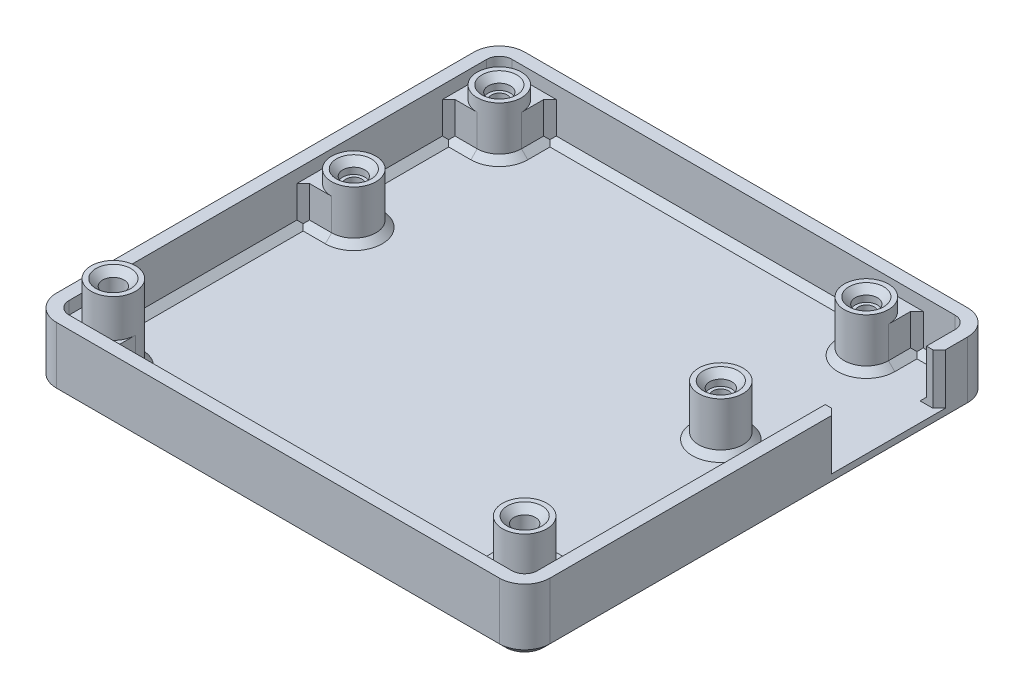
from build123d import *
from build123d.topology import SkipClean

# Parameters (mm, degrees)
BOSS_EXTRUDE1_DEPTH                  = 10
BOSS_EXTRUDE2_DEPTH                  = 2
SKETCH4_R                            = 3.5
BOSS_EXTRUDE3_DEPTH                  = 8
BOSS_EXTRUDE4_DEPTH                  = 12
CHAMFER3_SIZE                        = 1
CUT_EXTRUDE2_DEPTH                   = 4
CUT_EXTRUDE2_DEPTH_BACK              = 2
CHAMFER4_SIZE                        = 1
CHAMFER5_SIZE                        = 1
F_2_5_2_5_DIAMETER_HOLE1_D           = 2.5
F_2_5_2_5_DIAMETER_HOLE1_DEPTH       = 8
F_2_5_2_5_DIAMETER_HOLE1_CSINK_D     = 5.5
F_2_5_2_5_DIAMETER_HOLE1_CSINK_ANGLE = 90
F_3_5_3_5_DIAMETER_HOLE1_D           = 3.5
F_3_5_3_5_DIAMETER_HOLE1_DEPTH       = 2
F_2_5_2_5_DIAMETER_HOLE2_D           = 2.5
F_2_5_2_5_DIAMETER_HOLE2_DEPTH       = 12
F_2_5_2_5_DIAMETER_HOLE2_CSINK_D     = 5.5
F_2_5_2_5_DIAMETER_HOLE2_CSINK_ANGLE = 90
F_3_4_3_4_DIAMETER_HOLE1_D           = 3.4
F_3_4_3_4_DIAMETER_HOLE1_DEPTH       = 4
CUT_EXTRUDE3_REACH                   = 99.834
SKETCH21_W                           = 16
SKETCH21_H                           = 8
CHAMFER9_SIZE                        = 1


with BuildPart() as part:
    # Sketch2 → Boss-Extrude1 (new body)
    with BuildSketch(Plane(origin=(0, 0, 0), x_dir=(1, 0, 0), z_dir=(0, 1, 0))):
        with BuildLine():
            Line((-68.616981764, 12.627854819), (-68.616981764, -53.372145181))
            ThreePointArc((-68.616981764, -53.372145181), (-67.445408889, -56.200572306), (-64.616981764, -57.372145181))
            Line((-64.616981764, -57.372145181), (5.383018236, -57.372145181))
            ThreePointArc((5.383018236, -57.372145181), (8.211445361, -56.200572306), (9.383018236, -53.372145181))
            Line((9.383018236, -53.372145181), (9.383018236, 12.627854819))
            ThreePointArc((9.383018236, 12.627854819), (8.211445361, 15.456281944), (5.383018236, 16.627854819))
            Line((5.383018236, 16.627854819), (-64.616981764, 16.627854819))
            ThreePointArc((-64.616981764, 16.627854819), (-67.445408889, 15.456281944), (-68.616981764, 12.627854819))
        make_face()
        with BuildLine():
            Line((-66.616981764, 12.627854819), (-66.616981764, -53.372145181))
            ThreePointArc((-66.616981764, -53.372145181), (-66.031195326, -54.786358744), (-64.616981764, -55.372145181))
            Line((-64.616981764, -55.372145181), (5.383018236, -55.372145181))
            ThreePointArc((5.383018236, -55.372145181), (6.797231798, -54.786358744), (7.383018236, -53.372145181))
            Line((7.383018236, -53.372145181), (7.383018236, 12.627854819))
            ThreePointArc((7.383018236, 12.627854819), (6.797231798, 14.042068381), (5.383018236, 14.627854819))
            Line((5.383018236, 14.627854819), (-64.616981764, 14.627854819))
            ThreePointArc((-64.616981764, 14.627854819), (-66.031195326, 14.042068381), (-66.616981764, 12.627854819))
        make_face(mode=Mode.SUBTRACT)
    extrude(amount=BOSS_EXTRUDE1_DEPTH)

    # Sketch2<3> → Boss-Extrude2 (add)
    with BuildSketch(Plane(origin=(0, 0, 0), x_dir=(1, 0, 0), z_dir=(0, 1, 0))):
        with BuildLine():
            Line((-64.616981764, 14.627854819), (5.383018236, 14.627854819))
            ThreePointArc((5.383018236, 14.627854819), (6.797231798, 14.042068381), (7.383018236, 12.627854819))
            Line((7.383018236, 12.627854819), (7.383018236, -53.372145181))
            ThreePointArc((7.383018236, -53.372145181), (6.797231798, -54.786358744), (5.383018236, -55.372145181))
            Line((5.383018236, -55.372145181), (-64.616981764, -55.372145181))
            ThreePointArc((-64.616981764, -55.372145181), (-66.031195326, -54.786358744), (-66.616981764, -53.372145181))
            Line((-66.616981764, -53.372145181), (-66.616981764, 12.627854819))
            ThreePointArc((-66.616981764, 12.627854819), (-66.031195326, 14.042068381), (-64.616981764, 14.627854819))
        make_face()
    extrude(amount=BOSS_EXTRUDE2_DEPTH)

    # Sketch4 → Boss-Extrude3 (add)
    with BuildSketch(Plane(origin=(0, 2, 0), x_dir=(1, 0, 0), z_dir=(0, 1, 0))):
        with Locations(Location((-4.116981764, -12.872145181, 0), (0, 0, 90))):
            Circle(SKETCH4_R)
        with BuildLine():
            Line((-0.616981764, 14.627854819), (-0.616981764, 10.127854819))
            ThreePointArc((-0.616981764, 10.127854819), (-4.116981764, 6.627854819), (-7.616981764, 10.127854819))
            Line((-7.616981764, 10.127854819), (-7.616981764, 14.627854819))
            Line((-7.616981764, 14.627854819), (-0.616981764, 14.627854819))
        make_face()
        with BuildLine():
            Line((-66.616981764, -16.372145181), (-62.116981764, -16.372145181))
            ThreePointArc((-62.116981764, -16.372145181), (-58.616981764, -12.872145181), (-62.116981764, -9.372145181))
            Line((-62.116981764, -9.372145181), (-66.616981764, -9.372145181))
            Line((-66.616981764, -9.372145181), (-66.616981764, -16.372145181))
        make_face()
        with BuildLine():
            Line((-58.616981764, 14.627854819), (-64.616981764, 14.627854819))
            ThreePointArc((-64.616981764, 14.627854819), (-66.031195326, 14.042068381), (-66.616981764, 12.627854819))
            Line((-66.616981764, 12.627854819), (-66.616981764, 6.627854819))
            Line((-66.616981764, 6.627854819), (-62.116981764, 6.627854819))
            ThreePointArc((-62.116981764, 6.627854819), (-59.64210803, 7.652981085), (-58.616981764, 10.127854819))
            Line((-58.616981764, 10.127854819), (-58.616981764, 14.627854819))
        make_face()
    extrude(amount=BOSS_EXTRUDE3_DEPTH)

    # Sketch9 → Boss-Extrude4 (add)
    with BuildSketch(Plane(origin=(0, 2, 0), x_dir=(1, 0, 0), z_dir=(0, 1, 0))):
        with BuildLine():
            Line((-62.116981764, -47.372145181), (-66.616981764, -47.372145181))
            Line((-66.616981764, -47.372145181), (-66.616981764, -53.372145181))
            ThreePointArc((-66.616981764, -53.372145181), (-66.031195326, -54.786358744), (-64.616981764, -55.372145181))
            Line((-64.616981764, -55.372145181), (-58.616981764, -55.372145181))
            Line((-58.616981764, -55.372145181), (-58.616981764, -50.872145181))
            ThreePointArc((-58.616981764, -50.872145181), (-59.64210803, -48.397271447), (-62.116981764, -47.372145181))
        make_face()
        with BuildLine():
            Line((2.883018236, -47.372145181), (7.383018236, -47.372145181))
            Line((7.383018236, -47.372145181), (7.383018236, -53.372145181))
            ThreePointArc((7.383018236, -53.372145181), (6.797231798, -54.786358744), (5.383018236, -55.372145181))
            Line((5.383018236, -55.372145181), (-0.616981764, -55.372145181))
            Line((-0.616981764, -55.372145181), (-0.616981764, -50.872145181))
            ThreePointArc((-0.616981764, -50.872145181), (0.408144502, -48.397271447), (2.883018236, -47.372145181))
        make_face()
    extrude(amount=BOSS_EXTRUDE4_DEPTH)

    # Chamfer3
    chamfer3_edges = [part.edges().sort_by_distance(p)[0] for p in [
        (-68.616981764, 0, 20.372145181),
        (-67.445408889, 0, -15.456281944),
        (-29.616981764, 0, -16.627854819),
        (8.211445361, 0, -15.456281944),
        (9.383018236, 0, 20.372145181),
        (8.211445361, 0, 56.200572306),
        (-29.616981764, 0, 57.372145181),
        (-67.445408889, 0, 56.200572306),
    ]]
    chamfer(chamfer3_edges, length=CHAMFER3_SIZE)

    # Sketch12 → Cut-Extrude2 (cut, two sides: drawn at the far end of the back side and taken through both)
    with SkipClean():  # the faces are left unmerged after this step: merging them gives an invalid solid
        with BuildSketch(Plane(origin=(0, 10, 0), x_dir=(1, 0, 0), z_dir=(0, 1, 0)).offset(-CUT_EXTRUDE2_DEPTH_BACK)):
            with BuildLine():
                Line((-58.616981764, 10.127854819), (-58.616981764, 14.627854819))
                Line((-58.616981764, 14.627854819), (-64.616981764, 14.627854819))
                ThreePointArc((-64.616981764, 14.627854819), (-66.031195326, 14.042068381), (-66.616981764, 12.627854819))
                Line((-66.616981764, 12.627854819), (-66.616981764, 6.627854819))
                Line((-66.616981764, 6.627854819), (-62.116981764, 6.627854819))
                ThreePointArc((-62.116981764, 6.627854819), (-64.591855498, 12.602728553), (-58.616981764, 10.127854819))
            make_face()
            with BuildLine():
                Line((-64.616981764, -55.372145181), (-58.616981764, -55.372145181))
                Line((-58.616981764, -55.372145181), (-58.616981764, -50.872145181))
                ThreePointArc((-58.616981764, -50.872145181), (-64.591855498, -53.347018915), (-62.116981764, -47.372145181))
                Line((-62.116981764, -47.372145181), (-66.616981764, -47.372145181))
                Line((-66.616981764, -47.372145181), (-66.616981764, -53.372145181))
                ThreePointArc((-66.616981764, -53.372145181), (-66.031195326, -54.786358744), (-64.616981764, -55.372145181))
            make_face()
            with BuildLine():
                Line((-0.616981764, -50.872145181), (-0.616981764, -55.372145181))
                Line((-0.616981764, -55.372145181), (5.383018236, -55.372145181))
                ThreePointArc((5.383018236, -55.372145181), (6.797231798, -54.786358744), (7.383018236, -53.372145181))
                Line((7.383018236, -53.372145181), (7.383018236, -47.372145181))
                Line((7.383018236, -47.372145181), (2.883018236, -47.372145181))
                ThreePointArc((2.883018236, -47.372145181), (5.35789197, -53.347018915), (-0.616981764, -50.872145181))
            make_face()
            with BuildLine():
                Line((-7.616981764, 10.127854819), (-7.616981764, 14.627854819))
                Line((-7.616981764, 14.627854819), (-0.616981764, 14.627854819))
                Line((-0.616981764, 14.627854819), (-0.616981764, 10.127854819))
                ThreePointArc((-0.616981764, 10.127854819), (-4.116981764, 13.627854819), (-7.616981764, 10.127854819))
            make_face()
            with BuildLine():
                Line((-66.616981764, -16.372145181), (-66.616981764, -9.372145181))
                Line((-66.616981764, -9.372145181), (-62.116981764, -9.372145181))
                ThreePointArc((-62.116981764, -9.372145181), (-65.616981764, -12.872145181), (-62.116981764, -16.372145181))
                Line((-62.116981764, -16.372145181), (-66.616981764, -16.372145181))
            make_face()
        extrude(amount=CUT_EXTRUDE2_DEPTH + CUT_EXTRUDE2_DEPTH_BACK, mode=Mode.SUBTRACT)

    # Chamfer4
    # the kernel refuses this chamfer: 1 mm, written as the material it adds along each edge
    with BuildSketch(Plane(origin=(7.383018236, 2, 47.372145181), x_dir=(0.027495876610586414, 0, -0.9996219169112968), z_dir=(0, 1, 0)), Plane(origin=(-66.616981764, 2, -6.627854819), x_dir=(-0.02749587661058217, 0, 0.9996219169112968), z_dir=(0, 1, 0)), Plane(origin=(-58.616981764, 2, 55.372145181), x_dir=(0.9996219169112968, 0, 0.027495876610589005), z_dir=(0, 1, 0)), Plane(origin=(-7.616981764, 2, -14.627854819), x_dir=(-0.9996219169112968, 0, -0.027495876610585623), z_dir=(0, 1, 0)), Plane(origin=(-66.616981764, 2, 16.372145181), x_dir=(-0.027495876610582105, 0, 0.999621916911297), z_dir=(0, 1, 0))) as chamfer4_piece_1:
        Polygon((CHAMFER4_SIZE * 0.999621916911, CHAMFER4_SIZE * 0.0274958766106), (-CHAMFER4_SIZE * 0.0274958766106, CHAMFER4_SIZE * 0.999621916911), (0, 0), align=None)
    extrude(amount=6)
    with BuildSketch(Plane(origin=(-58.616981764, 2, -14.627854819), x_dir=(0.9996219169112968, 0, -0.02749587661058555), z_dir=(0, 1, 0)), Plane(origin=(-66.616981764, 2, 47.372145181), x_dir=(-0.027495876610582105, 0, -0.999621916911297), z_dir=(0, 1, 0)), Plane(origin=(-0.616981764, 2, 55.372145181), x_dir=(-0.9996219169112965, 0, 0.027495876610589158), z_dir=(0, 1, 0)), Plane(origin=(-0.616981764, 2, -14.627854819), x_dir=(0.9996219169112968, 0, -0.027495876610585623), z_dir=(0, 1, 0)), Plane(origin=(-66.616981764, 2, 9.372145181), x_dir=(-0.0274958766105822, 0, -0.999621916911297), z_dir=(0, 1, 0))) as chamfer4_piece_2:
        Polygon((CHAMFER4_SIZE * 0.999621916911, -CHAMFER4_SIZE * 0.0274958766106), (-CHAMFER4_SIZE * 0.0274958766106, -CHAMFER4_SIZE * 0.999621916911), (0, 0), align=None)
    extrude(amount=6)

    # Chamfer5
    # the kernel refuses this chamfer: 1 mm, written as the material it adds along each edge
    with BuildSketch(Plane(origin=(-58.616981764, 2, 56.943828169), x_dir=(-0.02749587661058907, 0.9996219169112965, 0), z_dir=(0, 0, -1)), Plane(origin=(-62.116981764, 2, 47.372145181), x_dir=(0, 0.9996219169112968, 0.027495876610589075), z_dir=(-1, 0, 0)), Plane(origin=(-7.616981764, 2, -10.127854819), x_dir=(-0.9996219169112968, -0.02749587661058627, 0), z_dir=(0, 0, -1)), Plane(origin=(-0.616981764, 2, -16.199537807), x_dir=(0.9996219169112968, -0.027495876610586487, 0), z_dir=(0, 0, 1)), Plane(origin=(-68.188664752, 2, -6.627854819), x_dir=(0, 0.9996219169112968, -0.027495876610586487), z_dir=(1, 0, 0)), Plane(origin=(-68.188664752, 2, 16.372145181), x_dir=(0, 0.9996219169112968, -0.027495876610585623), z_dir=(1, 0, 0)), Plane(origin=(-62.116981764, 2, 9.372145181), x_dir=(0, 0.9996219169112968, 0.027495876610585623), z_dir=(-1, 0, 0))) as chamfer5_piece_1:
        Polygon((CHAMFER5_SIZE * 0.999621916911, CHAMFER5_SIZE * 0.0274958766106), (-CHAMFER5_SIZE * 0.0274958766106, CHAMFER5_SIZE * 0.999621916911), (0, 0), align=None)
    extrude(amount=6.071682988)
    with BuildSketch(Plane(origin=(-62.116981764, 2, 50.872145181), x_dir=(1, 0, 0), z_dir=(0, 0, 1))) as chamfer5_piece_2:
        Polygon((3.5, CHAMFER5_SIZE), (3.5 + CHAMFER5_SIZE, 0), (3.5, 0), align=None)
    revolve(axis=Axis((-62.116981764, 2, 50.872145181), (0, 1, 0)), revolution_arc=90)
    with BuildSketch(Plane(origin=(0.954701224, 2, 55.372145181), x_dir=(0, 0.9996219169112968, 0.027495876610589075), z_dir=(-1, 0, 0))) as chamfer5_piece_3:
        Polygon((CHAMFER5_SIZE * 0.999621916911, CHAMFER5_SIZE * 0.0274958766106), (-CHAMFER5_SIZE * 0.0274958766106, CHAMFER5_SIZE * 0.999621916911), (0, 0), align=None)
    extrude(amount=61.143365976)
    with BuildSketch(Plane(origin=(2.883018236, 2, 47.372145181), x_dir=(0, 0.9996219169112968, 0.027495876610589075), z_dir=(1, 0, 0)), Plane(origin=(-0.616981764, 2, 56.943828169), x_dir=(0.02749587661058638, 0.9996219169112968, 0), z_dir=(0, 0, -1)), Plane(origin=(-58.616981764, 2, -10.127854819), x_dir=(0.9996219169112968, -0.0274958766105862, 0), z_dir=(0, 0, -1))) as chamfer5_piece_4:
        Polygon((CHAMFER5_SIZE * 0.999621916911, -CHAMFER5_SIZE * 0.0274958766106), (-CHAMFER5_SIZE * 0.0274958766106, -CHAMFER5_SIZE * 0.999621916911), (0, 0), align=None)
    extrude(amount=6.071682988)
    with BuildSketch(Plane(origin=(2.883018236, 2, 50.872145181), x_dir=(-1, 0, 0), z_dir=(0, 0, 1))) as chamfer5_piece_5:
        Polygon((3.5, -CHAMFER5_SIZE), (3.5 + CHAMFER5_SIZE, 0), (3.5, 0), align=None)
    revolve(axis=Axis((2.883018236, 2, 50.872145181), (0, -1, 0)), revolution_arc=90)
    with BuildSketch(Plane(origin=(-4.116981764, 2, 12.872145181), x_dir=(0, 0, -1), z_dir=(1, 0, 0))) as chamfer5_piece_6:
        Polygon((3.5 + CHAMFER5_SIZE, 0), (3.5, CHAMFER5_SIZE), (3.5, 0), align=None)
    revolve(axis=Axis((-4.116981764, 2, 12.872145181), (0, 1, 0)))
    with BuildSketch(Plane(origin=(7.383018236, 2, -12.627854819), x_dir=(0.02749587661059166, 0.9996219169112965, 0), z_dir=(0, 0, 1))) as chamfer5_piece_7:
        Polygon((CHAMFER5_SIZE * 0.999621916911, CHAMFER5_SIZE * 0.0274958766106), (-CHAMFER5_SIZE * 0.0274958766106, CHAMFER5_SIZE * 0.999621916911), (0, 0), align=None)
    extrude(amount=61.571682988)
    with BuildSketch(Plane(origin=(-2.188664752, 2, -14.627854819), x_dir=(0, -0.02749587661058651, 0.9996219169112968), z_dir=(1, 0, 0))) as chamfer5_piece_8:
        Polygon((CHAMFER5_SIZE * 0.999621916911, -CHAMFER5_SIZE * 0.0274958766106), (-CHAMFER5_SIZE * 0.0274958766106, -CHAMFER5_SIZE * 0.999621916911), (0, 0), align=None)
    extrude(amount=7.571682988)
    with BuildSketch(Plane(origin=(5.383018236, 2, -12.627854819), x_dir=(0, 0, -1), z_dir=(-1, 0, 0))) as chamfer5_piece_9:
        Polygon((2, -CHAMFER5_SIZE), (2 - CHAMFER5_SIZE, 0), (2, 0), align=None)
    revolve(axis=Axis((5.383018236, 2, -12.627854819), (0, -1, 0)), revolution_arc=90)
    with BuildSketch(Plane(origin=(-4.116981764, 2, -10.127854819), x_dir=(1, 0, 0), z_dir=(0, 0, -1))) as chamfer5_piece_10:
        Polygon((3.5 + CHAMFER5_SIZE, 0), (3.5, -CHAMFER5_SIZE), (3.5, 0), align=None)
    revolve(axis=Axis((-4.116981764, 2, -10.127854819), (0, -1, 0)), revolution_arc=180)
    with BuildSketch(Plane(origin=(-60.188664752, 2, -14.627854819), x_dir=(0, -0.02749587661058651, 0.9996219169112968), z_dir=(1, 0, 0))) as chamfer5_piece_11:
        Polygon((CHAMFER5_SIZE * 0.999621916911, -CHAMFER5_SIZE * 0.0274958766106), (-CHAMFER5_SIZE * 0.0274958766106, -CHAMFER5_SIZE * 0.999621916911), (0, 0), align=None)
    extrude(amount=54.143365976)
    with BuildSketch(Plane(origin=(-62.116981764, 2, -10.127854819), x_dir=(0, 0, 1), z_dir=(-1, 0, 0))) as chamfer5_piece_12:
        Polygon((3.5, CHAMFER5_SIZE), (3.5 + CHAMFER5_SIZE, 0), (3.5, 0), align=None)
    revolve(axis=Axis((-62.116981764, 2, -10.127854819), (0, 1, 0)), revolution_arc=90)
    with BuildSketch(Plane(origin=(-66.616981764, 2, 10.943828169), x_dir=(-0.02749587661058217, 0.9996219169112968, 0), z_dir=(0, 0, -1))) as chamfer5_piece_13:
        Polygon((CHAMFER5_SIZE * 0.999621916911, CHAMFER5_SIZE * 0.0274958766106), (-CHAMFER5_SIZE * 0.0274958766106, CHAMFER5_SIZE * 0.999621916911), (0, 0), align=None)
    extrude(amount=19.143365976)
    with BuildSketch(Plane(origin=(-62.116981764, 2, 12.872145181), x_dir=(0, 0, 1), z_dir=(-1, 0, 0))) as chamfer5_piece_14:
        Polygon((3.5, CHAMFER5_SIZE), (3.5 + CHAMFER5_SIZE, 0), (3.5, 0), align=None)
    revolve(axis=Axis((-62.116981764, 2, 12.872145181), (0, 1, 0)), revolution_arc=180)
    with BuildSketch(Plane(origin=(-66.616981764, 2, 48.943828169), x_dir=(-0.02749587661058217, 0.9996219169112968, 0), z_dir=(0, 0, -1))) as chamfer5_piece_15:
        Polygon((CHAMFER5_SIZE * 0.999621916911, CHAMFER5_SIZE * 0.0274958766106), (-CHAMFER5_SIZE * 0.0274958766106, CHAMFER5_SIZE * 0.999621916911), (0, 0), align=None)
    extrude(amount=34.143365976)

    # Ø2.5 (2.5) Diameter Hole1
    with Locations(Plane(origin=(0, 10, 0), x_dir=(1, 0, 0), z_dir=(0, 1, 0))):
        with Locations((-62.116981764, 10.127854819), (-4.116981764, 10.127854819), (-62.116981764, -12.872145181), (-4.116981764, -12.872145181)):
            CounterSinkHole(F_2_5_2_5_DIAMETER_HOLE1_D / 2, F_2_5_2_5_DIAMETER_HOLE1_CSINK_D / 2, depth=F_2_5_2_5_DIAMETER_HOLE1_DEPTH, counter_sink_angle=F_2_5_2_5_DIAMETER_HOLE1_CSINK_ANGLE)

    # Ø3.5 (3.5) Diameter Hole1
    with Locations(Plane(origin=(0, 10, 0), x_dir=(1, 0, 0), z_dir=(0, 1, 0))):
        with Locations((-62.116981764, 10.127854819), (-4.116981764, 10.127854819), (-62.116981764, -12.872145181), (-4.116981764, -12.872145181)):
            Hole(F_3_5_3_5_DIAMETER_HOLE1_D / 2, depth=F_3_5_3_5_DIAMETER_HOLE1_DEPTH)

    # Ø2.5 (2.5) Diameter Hole2
    with Locations(Plane(origin=(0, 14, 0), x_dir=(1, 0, 0), z_dir=(0, 1, 0))):
        with Locations((-62.116981764, -50.872145181), (2.883018236, -50.872145181)):
            CounterSinkHole(F_2_5_2_5_DIAMETER_HOLE2_D / 2, F_2_5_2_5_DIAMETER_HOLE2_CSINK_D / 2, depth=F_2_5_2_5_DIAMETER_HOLE2_DEPTH, counter_sink_angle=F_2_5_2_5_DIAMETER_HOLE2_CSINK_ANGLE)

    # Ø3.4 (3.4) Diameter Hole1
    with Locations(Plane(origin=(0, 14, 0), x_dir=(1, 0, 0), z_dir=(0, 1, 0))):
        with Locations((-62.116981764, -50.872145181), (2.883018236, -50.872145181)):
            Hole(F_3_4_3_4_DIAMETER_HOLE1_D / 2, depth=F_3_4_3_4_DIAMETER_HOLE1_DEPTH)

    # Sketch21 → Cut-Extrude3 (cut, up to next)
    with BuildSketch(Plane(origin=(9.383018236, 0, 0), x_dir=(0, 0, -1), z_dir=(1, 0, 0)), mode=Mode.PRIVATE) as cut_extrude3_sk1:
        with Locations((0.127854819, 6)):
            Rectangle(SKETCH21_W, SKETCH21_H)
    cut_extrude3_tool1 = extrude(cut_extrude3_sk1.sketch, amount=-CUT_EXTRUDE3_REACH, mode=Mode.PRIVATE) & part.part
    add(cut_extrude3_tool1.solids().sort_by_distance((9.383018, 6, -0.127855))[0], mode=Mode.SUBTRACT)

    # Chamfer9
    chamfer9_edges = [part.edges().sort_by_distance(p)[0] for p in [
        (9.383018236, 6, 7.872145181),
        (9.383018236, 6, -8.127854819),
    ]]
    chamfer(chamfer9_edges, length=CHAMFER9_SIZE)


solid = part.part
